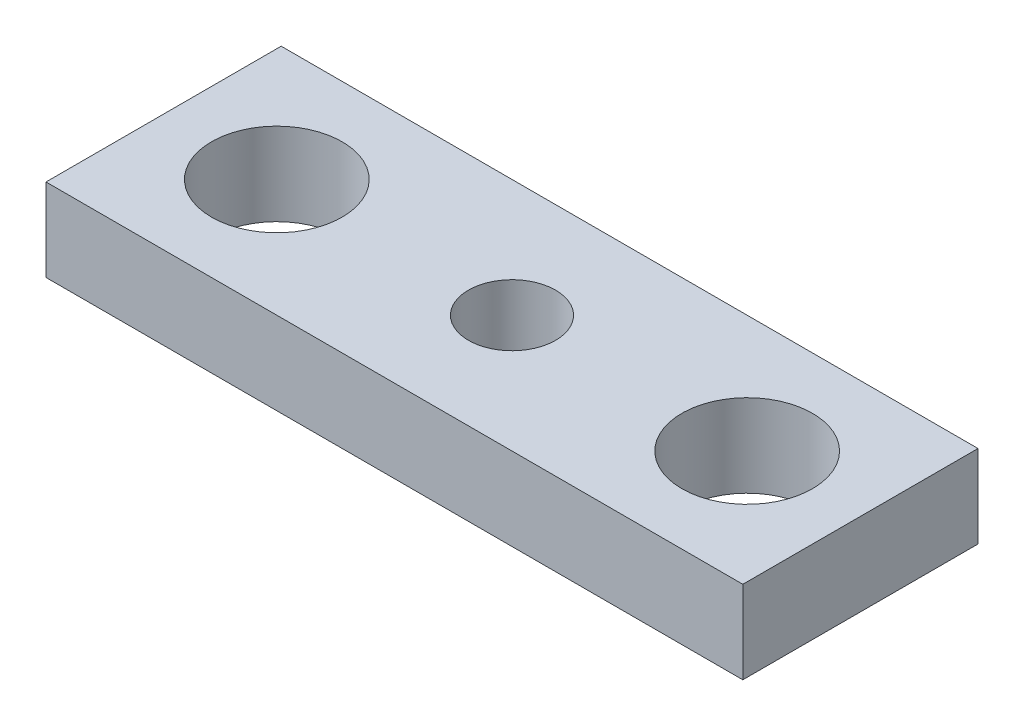
from build123d import *

# Parameters (mm, degrees)
SKETCH_1_W          = 80
SKETCH_1_H          = 27
EXTRUDE_1_DEPTH     = 9.5
SKETCH_3_R          = 7.5
CUT_EXTRUDE_1_DEPTH = 44.272393047
SKETCH_10_R         = 5
CUT_EXTRUDE_2_DEPTH = 44.272393047


with BuildPart() as part:
    # 草图1 → 凸台-拉伸1 (new body)
    with BuildSketch(Plane(origin=(0, 0, 0), x_dir=(1, 0, 0), z_dir=(0, 1, 0))):
        Rectangle(SKETCH_1_W, SKETCH_1_H)
    extrude(amount=EXTRUDE_1_DEPTH)

    # 草图3 → 切除-拉伸1 (cut, through all)
    with BuildSketch(Plane(origin=(0, 9.5, 0), x_dir=(1, 0, 0), z_dir=(0, 1, 0))):
        with Locations((-27, 0)):
            Circle(SKETCH_3_R)
        with Locations((27, 0)):
            Circle(SKETCH_3_R)
    extrude(amount=-CUT_EXTRUDE_1_DEPTH, mode=Mode.SUBTRACT)

    # 草图10 → 切除-拉伸2 (cut, through all)
    with BuildSketch(Plane.XZ):
        Circle(SKETCH_10_R)
    extrude(amount=-CUT_EXTRUDE_2_DEPTH, mode=Mode.SUBTRACT)


solid = part.part
